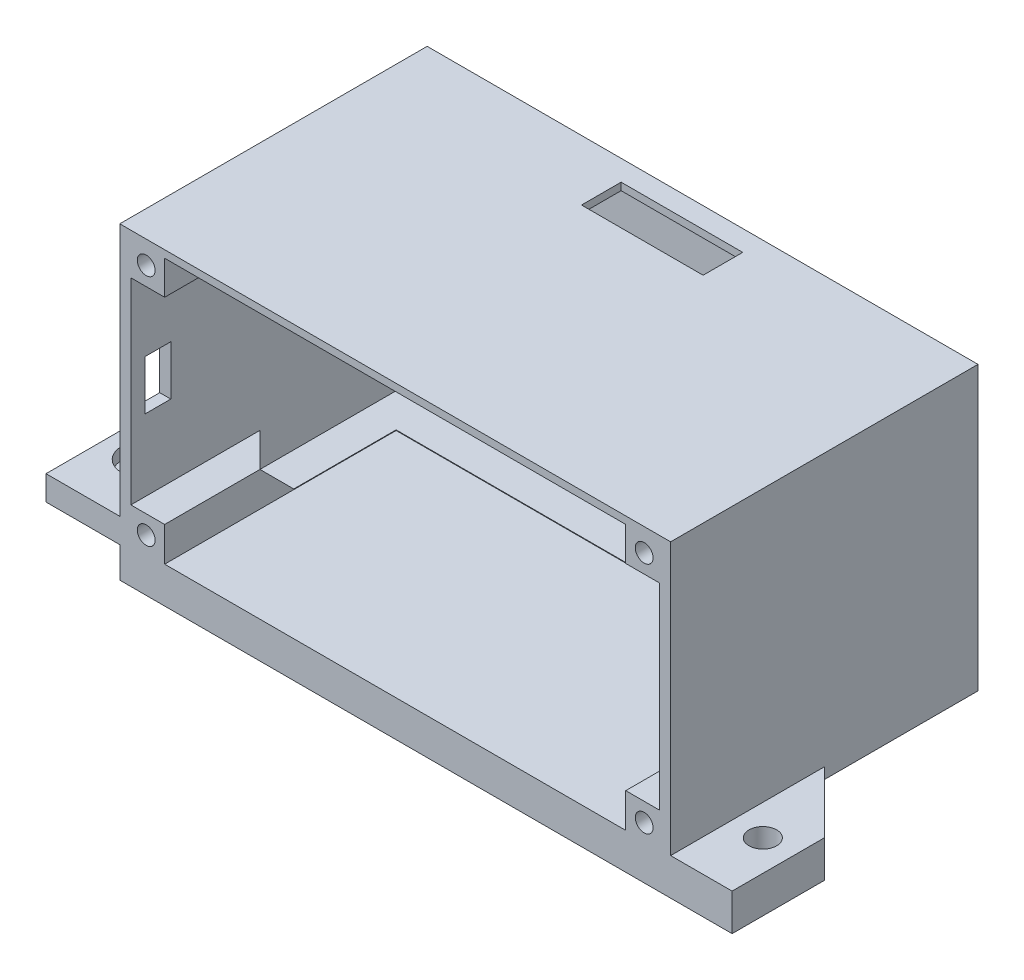
from build123d import *

# Parameters (mm, degrees)
SKIZZE1_W                       = 89.6
SKIZZE1_H                       = 46
SKIZZE1_W_2                     = 86
SKIZZE1_H_2                     = 43
AUFSATZ_LINEAR_AUSTRAGEN1_DEPTH = 1
SKIZZE1_3_W                     = 89.6
SKIZZE1_3_H                     = 46
SKIZZE1_3_W_2                   = 86
SKIZZE1_3_H_2                   = 43
AUFSATZ_LINEAR_AUSTRAGEN2_DEPTH = 50
SKIZZE2_W                       = 5.5
SKIZZE2_H                       = 5.5
SKIZZE2_R                       = 1.45
AUFSATZ_LINEAR_AUSTRAGEN3_DEPTH = 15
SKIZZE3_W                       = 5.5
SKIZZE3_H                       = 5.5
AUFSATZ_LINEAR_AUSTRAGEN4_DEPTH = 0.5
FASE1_SIZE                      = 5.5
SKIZZE4_W                       = 4.158916141
SKIZZE4_H                       = 8.076735696
SCHNITT_LINEAR_AUSTRAGEN1_DEPTH = 10
SKIZZE5_W                       = 22.047742135
SKIZZE5_H                       = 8.787632461
SCHNITT_LINEAR_AUSTRAGEN2_DEPTH = 10
SKIZZE6_W                       = 19.779455906
SKIZZE6_H                       = 6.441932887
SCHNITT_LINEAR_AUSTRAGEN3_DEPTH = 10
SKIZZE9_W                       = 20
SKIZZE9_H                       = 6
AUFSATZ_LINEAR_AUSTRAGEN6_DEPTH = 10
SKIZZE10_R                      = 2.25
SCHNITT_LINEAR_AUSTRAGEN5_DEPTH = 10
SKIZZE11_W                      = 75
SKIZZE11_H                      = 0.1
SCHNITT_LINEAR_AUSTRAGEN6_DEPTH = 37.646803
SKIZZE12_W                      = 12
SKIZZE12_H                      = 4
AUFSATZ_LINEAR_AUSTRAGEN7_DEPTH = 20
SCHNITT_LINEAR_AUSTRAGEN7_REACH = 88.161
SKIZZE13_R                      = 2.25
SKIZZE14_R                      = 3.7
SCHNITT_LINEAR_AUSTRAGEN8_DEPTH = 2
SKIZZE15_W                      = 89.6
SKIZZE15_H                      = 4.2
AUFSATZ_LINEAR_AUSTRAGEN8_DEPTH = 20
FASE2_SIZE                      = 4.5
FASE3_SIZE                      = 5
FASE4_SIZE                      = 5
FASE5_SIZE                      = 6


# Some blends are built 0.0001 mm under size
with BuildPart() as part:
    # Skizze1 → Aufsatz-Linear austragen1 (new body)
    # profile 1 of 2: a face of its own
    with BuildSketch(Plane.XY):
        with Locations((0, -0.3)):
            Rectangle(SKIZZE1_W, SKIZZE1_H)
        Rectangle(SKIZZE1_W_2, SKIZZE1_H_2, mode=Mode.SUBTRACT)
    # profile 2 of 2: a face of its own
    with BuildSketch(Plane.XY):
        Rectangle(SKIZZE1_W_2, SKIZZE1_H_2)
    extrude(amount=AUFSATZ_LINEAR_AUSTRAGEN1_DEPTH)

    # Skizze1<3> → Aufsatz-Linear austragen2 (add)
    with BuildSketch(Plane.XY):
        with Locations((0, -0.3)):
            Rectangle(SKIZZE1_3_W, SKIZZE1_3_H)
        Rectangle(SKIZZE1_3_W_2, SKIZZE1_3_H_2, mode=Mode.SUBTRACT)
    extrude(amount=AUFSATZ_LINEAR_AUSTRAGEN2_DEPTH)

    # Skizze2 → Aufsatz-Linear austragen3 (add)
    # profile 1 of 4: a face of its own
    with BuildSketch(Plane.XY.offset(50)):
        with Locations((-40.25, 18.75)):
            Rectangle(SKIZZE2_W, SKIZZE2_H)
        with Locations((-40.5, 19)):
            Circle(SKIZZE2_R, mode=Mode.SUBTRACT)
    # profile 2 of 4: a face of its own
    with BuildSketch(Plane.XY.offset(50)):
        with Locations((-40.25, -18.75)):
            Rectangle(SKIZZE2_W, SKIZZE2_H)
        with Locations(Location((-40.5, -19, 0), (0, 0, 180))):
            Circle(SKIZZE2_R, mode=Mode.SUBTRACT)
    # profile 3 of 4: a face of its own
    with BuildSketch(Plane.XY.offset(50)):
        with Locations((40.25, -18.75)):
            Rectangle(SKIZZE2_W, SKIZZE2_H)
        with Locations((40.5, -19)):
            Circle(SKIZZE2_R, mode=Mode.SUBTRACT)
    # profile 4 of 4: a face of its own
    with BuildSketch(Plane.XY.offset(50)):
        with Locations((40.25, 18.75)):
            Rectangle(SKIZZE2_W, SKIZZE2_H)
        with Locations(Location((40.5, 19, 0), (0, 0, 180))):
            Circle(SKIZZE2_R, mode=Mode.SUBTRACT)
    extrude(amount=-AUFSATZ_LINEAR_AUSTRAGEN3_DEPTH)

    # Skizze3 → Aufsatz-Linear austragen4 (add)
    with BuildSketch(Plane(origin=(0, 0, 35), x_dir=(-1, 0, 0), z_dir=(0, 0, -1))):
        with Locations((-40.25, 18.75)):
            Rectangle(SKIZZE3_W, SKIZZE3_H)
        with Locations((-40.25, -18.75)):
            Rectangle(SKIZZE3_W, SKIZZE3_H)
        with Locations((40.25, -18.75)):
            Rectangle(SKIZZE3_W, SKIZZE3_H)
        with Locations((40.25, 18.75)):
            Rectangle(SKIZZE3_W, SKIZZE3_H)
    extrude(amount=AUFSATZ_LINEAR_AUSTRAGEN4_DEPTH)

    # Fase1
    fase1_edges = [part.edges().sort_by_distance(p)[0] for p in [
        (43, 18.75, 34.5),
        (40.25, 21.5, 34.5),
        (-40.25, -21.5, 34.5),
        (-43, -18.75, 34.5),
        (-43, 18.75, 34.5),
        (-40.25, 21.5, 34.5),
        (40.25, -21.5, 34.5),
        (43, -18.75, 34.5),
    ]]
    chamfer(fase1_edges, length=FASE1_SIZE - 0.0001)  # a hair under: the kernel refuses the full size

    # Skizze4 → Schnitt-Linear austragen1 (cut)
    with BuildSketch(Plane.ZY.offset(44.8)):
        with Locations((45.583621194, -0.3)):
            Rectangle(SKIZZE4_W, SKIZZE4_H)
    extrude(amount=-SCHNITT_LINEAR_AUSTRAGEN1_DEPTH, mode=Mode.SUBTRACT)

    # Skizze5 → Schnitt-Linear austragen2 (cut)
    with BuildSketch(Plane.XZ.offset(23.3)):
        with Locations((11.862553209, 7.95938084)):
            Rectangle(SKIZZE5_W, SKIZZE5_H)
    extrude(amount=-SCHNITT_LINEAR_AUSTRAGEN2_DEPTH, mode=Mode.SUBTRACT)

    # Skizze6 → Schnitt-Linear austragen3 (cut)
    with BuildSketch(Plane(origin=(0, 22.7, 0), x_dir=(1, 0, 0), z_dir=(0, 1, 0))):
        with Locations((0, -6.581515831)):
            Rectangle(SKIZZE6_W, SKIZZE6_H)
    extrude(amount=-SCHNITT_LINEAR_AUSTRAGEN3_DEPTH, mode=Mode.SUBTRACT)

    # Skizze9 → Aufsatz-Linear austragen6 (add)
    with BuildSketch(Plane(origin=(44.8, 0, 0), x_dir=(0, 0, -1), z_dir=(1, 0, 0))):
        with Locations((-40, -24.5)):
            Rectangle(SKIZZE9_W, SKIZZE9_H)
    extrude(amount=AUFSATZ_LINEAR_AUSTRAGEN6_DEPTH)

    # Skizze10 → Schnitt-Linear austragen5 (cut)
    with BuildSketch(Plane(origin=(0, -21.5, 0), x_dir=(1, 0, 0), z_dir=(0, 1, 0))):
        with Locations(Location((49.8, -40, 0), (0, 0, 180))):
            Circle(SKIZZE10_R)
        with Locations((-49.8, -40)):
            Circle(SKIZZE10_R)
    extrude(amount=-SCHNITT_LINEAR_AUSTRAGEN5_DEPTH, mode=Mode.SUBTRACT)

    # Skizze11 → Schnitt-Linear austragen6 (cut)
    with BuildSketch(Plane.XY.offset(50)):
        with Locations((0, -21.55)):
            Rectangle(SKIZZE11_W, SKIZZE11_H)
    extrude(amount=-SCHNITT_LINEAR_AUSTRAGEN6_DEPTH, mode=Mode.SUBTRACT)

    # Skizze12 → Aufsatz-Linear austragen7 (add)
    with BuildSketch(Plane.XY.offset(50)):
        with Locations((-50.8, -20.500000001)):
            Rectangle(SKIZZE12_W, SKIZZE12_H)
    extrude(amount=-AUFSATZ_LINEAR_AUSTRAGEN7_DEPTH)

    # Skizze13 → Schnitt-Linear austragen7 (cut, up to next)
    with BuildSketch(Plane(origin=(0, -18.500000001, 0), x_dir=(1, 0, 0), z_dir=(0, 1, 0)), mode=Mode.PRIVATE) as schnitt_linear_austragen7_sk1:
        with Locations(Location((-50.8, -40, 0), (0, 0, 180))):
            Circle(SKIZZE13_R)
    schnitt_linear_austragen7_tool1 = extrude(schnitt_linear_austragen7_sk1.sketch, amount=-SCHNITT_LINEAR_AUSTRAGEN7_REACH, mode=Mode.PRIVATE) & part.part
    add(schnitt_linear_austragen7_tool1.solids().sort_by_distance((-50.8, -18.5, 40))[0], mode=Mode.SUBTRACT)

    # Skizze14 → Schnitt-Linear austragen8 (cut)
    with BuildSketch(Plane(origin=(0, -18.500000001, 0), x_dir=(1, 0, 0), z_dir=(0, 1, 0))):
        with Locations(Location((-50.8, -40, 0), (0, 0, 180))):
            Circle(SKIZZE14_R)
    extrude(amount=-SCHNITT_LINEAR_AUSTRAGEN8_DEPTH, mode=Mode.SUBTRACT)

    # Skizze15 → Aufsatz-Linear austragen8 (add)
    with BuildSketch(Plane.XY.offset(50)):
        with Locations((0, -25.4)):
            Rectangle(SKIZZE15_W, SKIZZE15_H)
    extrude(amount=-AUFSATZ_LINEAR_AUSTRAGEN8_DEPTH)

    # Fase2
    # the kernel refuses this chamfer: 4.5 mm, written as the material it adds along each edge
    with BuildSketch(Plane(origin=(-44.8, -23.3, 30), x_dir=(0, 0.02749587661058602, -0.9996219169112969), z_dir=(1, 0, 0))) as fase2_piece_1_section:
        Polygon((FASE2_SIZE * 0.999621916911, -FASE2_SIZE * 0.0274958766106), (-FASE2_SIZE * 0.0274958766106, -FASE2_SIZE * 0.999621916911), (0, 0), align=None)
    fase2_piece_1 = extrude(amount=89.6, mode=Mode.PRIVATE)
    fase2_piece_1 = split(fase2_piece_1, bisect_by=Plane(origin=(0, -27.5, 28.499089477), z_dir=(0, 1, 0)), keep=Keep.TOP, mode=Mode.PRIVATE)
    add(fase2_piece_1)

    # Fase3
    fase3_edges = [part.edges().sort_by_distance(p)[0] for p in [
        (44.8, -24.5, 30),
    ]]
    chamfer(fase3_edges, length=FASE3_SIZE)

    # Fase4
    fase4_edges = [part.edges().sort_by_distance(p)[0] for p in [
        (54.8, -24.5, 30),
    ]]
    chamfer(fase4_edges, length=FASE4_SIZE - 0.0001)  # a hair under: the kernel refuses the full size

    # Fase5
    fase5_edges = [part.edges().sort_by_distance(p)[0] for p in [
        (-44.8, -20.500000001, 30),
    ]]
    chamfer(fase5_edges, length=FASE5_SIZE)
    fase5_2_edges = [part.edges().sort_by_distance(p)[0] for p in [
        (-56.8, -20.500000001, 30),
    ]]
    chamfer(fase5_2_edges, length=FASE5_SIZE - 0.0001)  # a hair under: the kernel refuses the full size


solid = part.part
